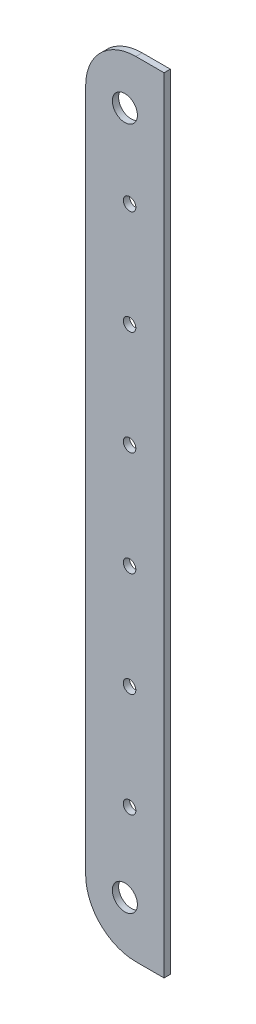
from build123d import *

# Parameters (mm, degrees)
SKETCH1_R           = 4
BOSS_EXTRUDE1_DEPTH = 2
SKETCH2_R           = 2
CUT_EXTRUDE1_DEPTH  = 2


with BuildPart() as part:
    # Sketch1 → Boss-Extrude1 (new body)
    with BuildSketch(Plane.XY):
        with BuildLine():
            Line((3.5, 125), (12.5, 125))
            Line((12.5, 125), (12.5, -125))
            Line((12.5, -125), (3.5, -125))
            ThreePointArc((3.5, -125), (-7.813708499, -120.313708499), (-12.5, -109))
            Line((-12.5, -109), (-12.5, 109))
            ThreePointArc((-12.5, 109), (-7.813708499, 120.313708499), (3.5, 125))
        make_face()
        with Locations((0, 109)):
            Circle(SKETCH1_R, mode=Mode.SUBTRACT)
        with Locations((0, -109)):
            Circle(SKETCH1_R, mode=Mode.SUBTRACT)
    extrude(amount=BOSS_EXTRUDE1_DEPTH)

    # Sketch2 → Cut-Extrude1 (cut)
    with BuildSketch(Plane.XY.offset(2)):
        with Locations((1.5, 83.3)):
            Circle(SKETCH2_R)
        with Locations((1.5, 50)):
            Circle(SKETCH2_R)
        with Locations((1.5, 16.7)):
            Circle(SKETCH2_R)
        with Locations((1.5, -16.7)):
            Circle(SKETCH2_R)
        with Locations((1.5, -50)):
            Circle(SKETCH2_R)
        with Locations((1.5, -83.3)):
            Circle(SKETCH2_R)
    extrude(amount=-CUT_EXTRUDE1_DEPTH, mode=Mode.SUBTRACT)


solid = part.part
